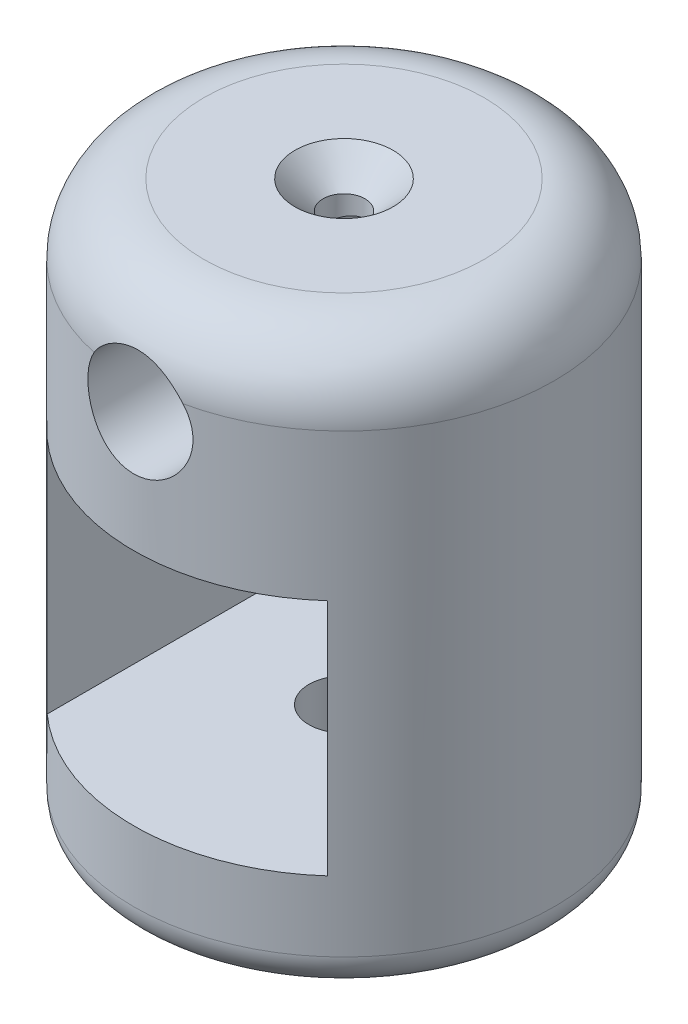
from build123d import *

# Parameters (mm, degrees)
SKETCH1_R               = 15
BOSS_EXTRUDE1_DEPTH     = 40
CUT_EXTRUDE1_DEPTH      = 40
CUT_EXTRUDE1_DEPTH_BACK = 40
SKETCH2_R               = 3.75
SKETCH4_R               = 1.5
CUT_EXTRUDE2_DEPTH      = 8
SKETCH5_R               = 2.5
CUT_EXTRUDE3_DEPTH      = 8
FILLET1_R               = 5
CHAMFER1_SIZE           = 2
FILLET2_R               = 2.5


with BuildPart() as part:
    # Sketch1 → Boss-Extrude1 (new body)
    with BuildSketch(Plane(origin=(0, 0, 0), x_dir=(1, 0, 0), z_dir=(0, 1, 0))):
        with Locations(Location((0, 0, 0), (0, 0, 270))):
            Circle(SKETCH1_R)
    extrude(amount=BOSS_EXTRUDE1_DEPTH)

    # Sketch2 → Cut-Extrude1 (cut, two sides: drawn at the far end of the back side and taken through both)
    with BuildSketch(Plane.XY.offset(-CUT_EXTRUDE1_DEPTH_BACK)):
        Polygon((10, 7.5), (0, 7.5), (-10, 7.5), (-10, 24.5), (10, 24.5), align=None)
        with Locations(Location((0, 33, 0), (0, 0, 89.999999996))):
            Circle(SKETCH2_R)
    extrude(amount=CUT_EXTRUDE1_DEPTH + CUT_EXTRUDE1_DEPTH_BACK, mode=Mode.SUBTRACT)

    # Sketch4 → Cut-Extrude2 (cut)
    with BuildSketch(Plane(origin=(0, 40, 0), x_dir=(1, 0, 0), z_dir=(0, 1, 0))):
        with Locations(Location((0, 0, 0), (0, 0, 270))):
            Circle(SKETCH4_R)
    extrude(amount=-CUT_EXTRUDE2_DEPTH, mode=Mode.SUBTRACT)

    # Sketch5 → Cut-Extrude3 (cut)
    with BuildSketch(Plane.XZ):
        with Locations(Location((0, 0, 0), (0, 0, 270))):
            Circle(SKETCH5_R)
    extrude(amount=-CUT_EXTRUDE3_DEPTH, mode=Mode.SUBTRACT)

    # Fillet1
    # the kernel refuses this fillet: 5 mm, written as the material it takes off along each edge
    with BuildSketch(Plane(origin=(0, 40, 0), x_dir=(0, 0, 1), z_dir=(-1, 0, 0))) as fillet1_piece_1:
        with BuildLine():
            CenterArc((15 - FILLET1_R, -FILLET1_R), FILLET1_R, 0, 90)
            Line((15 - FILLET1_R, 0), (15, 0))
            Line((15, 0), (15, -FILLET1_R))
        make_face()
    revolve(axis=Axis((0, 40, 0), (0, 1, 0)), mode=Mode.SUBTRACT)

    # Chamfer1
    chamfer1_edges = [part.edges().sort_by_distance(p)[0] for p in [
        (0, 40, -1.5),
    ]]
    chamfer(chamfer1_edges, length=CHAMFER1_SIZE)

    # Fillet2
    fillet2_edges = [part.edges().sort_by_distance(p)[0] for p in [
        (0, 0, -15),
    ]]
    fillet(fillet2_edges, radius=FILLET2_R)


solid = part.part
